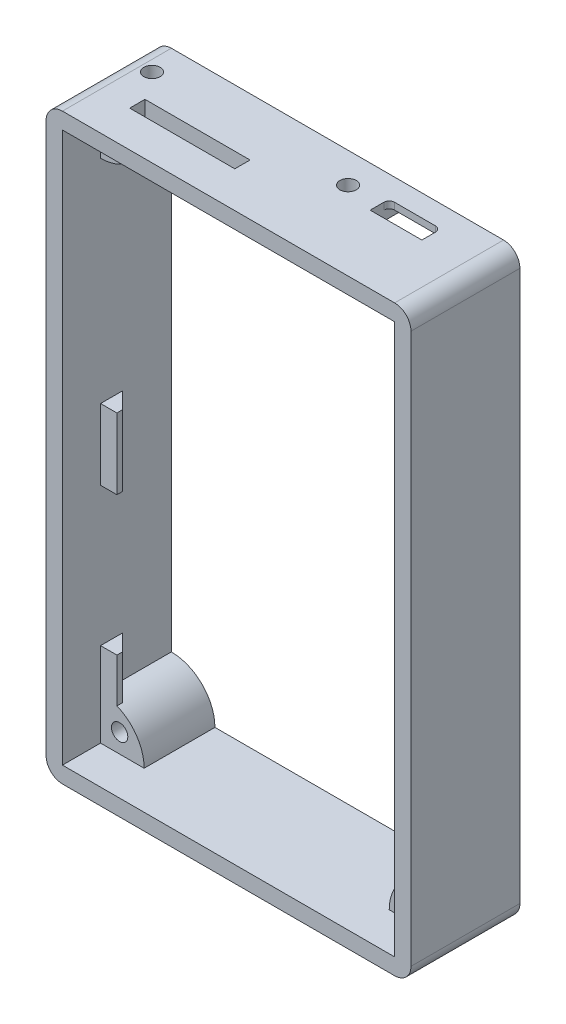
from build123d import *

# Parameters (mm, degrees)
SKICA1_W                 = 67
SKICA1_H                 = 107
SKICA1_W_2               = 61
SKICA1_H_2               = 101
P_IDAT_VYSUNUT_M1_DEPTH  = 7
P_IDAT_VYSUNUT_M2_DEPTH  = 13
SKICA3_R                 = 1.5
ODEBRAT_VYSUNUT_M1_DEPTH = 13
ODEBRAT_START            = -4.8
ODEBRAT_VYSUNUT_M2_DEPTH = 4.8
ODEBRAT_VYSUNUT_M4_DEPTH = 123.804723036
ZAOBLIT1_R               = 3
SKICA5_W                 = 4
SKICA5_H                 = 8.5
SKICA5_H_2               = 13
P_IDAT_VYSUNUT_M3_DEPTH  = 3
ZKOSEN_1_SIZE            = 3
SKICA6_W                 = 4
SKICA6_H                 = 8.5
SKICA6_H_2               = 13
P_IDAT_VYSUNUT_M4_DEPTH  = 3
ZKOSEN_2_SIZE            = 3
SKICA7_W                 = 9.5
SKICA7_H                 = 7.5
ODEBRAT_VYSUNUT_M3_DEPTH = 10
SKICA9_W                 = 9.5
SKICA9_H                 = 1.25
P_IDAT_VYSUNUT_M5_DEPTH  = 4
ZAOBLIT2_R               = 1
SKICA10_W                = 19.3
SKICA10_H                = 2.8
ODEBRAT_VYSUNUT_M5_DEPTH = 6
SKICA11_R                = 1.5
ODEBRAT_VYSUNUT_M6_DEPTH = 4
SKICA13_R                = 2.5
P_IDAT_VYSUNUT_M6_DEPTH  = 1


with BuildPart() as part:
    # Skica1 → Přidat vysunutím1 (new body)
    with BuildSketch(Plane.XY):
        with Locations((30.5, 50.5)):
            Rectangle(SKICA1_W, SKICA1_H)
        with Locations((30.5, 50.5)):
            Rectangle(SKICA1_W_2, SKICA1_H_2, mode=Mode.SUBTRACT)
    extrude(amount=P_IDAT_VYSUNUT_M1_DEPTH)

    # Skica2 → Přidat vysunutím2 (add)
    with BuildSketch(Plane(origin=(0, 0, 0), x_dir=(-1, 0, 0), z_dir=(0, 0, -1))):
        with BuildLine():
            ThreePointArc((-53, 0), (-53.14730658, -1.5281381), (-53.583801513, -3))
            Line((-53.583801513, -3), (-7.416198487, -3))
            ThreePointArc((-7.416198487, -3), (-7.85269342, -1.5281381), (-8, 0))
            Line((-8, 0), (-53, 0))
        make_face()
        with BuildLine():
            ThreePointArc((-61, 8), (-62.5281381, 7.85269342), (-64, 7.416198487))
            Line((-64, 7.416198487), (-64, -3))
            Line((-64, -3), (-53.583801513, -3))
            ThreePointArc((-53.583801513, -3), (-53.14730658, -1.5281381), (-53, 0))
            Line((-53, 0), (-61, 0))
            Line((-61, 0), (-61, 8))
        make_face()
        with BuildLine():
            ThreePointArc((-53, 0), (-55.343145751, 5.656854249), (-61, 8))
            Line((-61, 8), (-61, 0))
            Line((-61, 0), (-53, 0))
        make_face()
        with BuildLine():
            ThreePointArc((-61, 93), (-62.5281381, 93.14730658), (-64, 93.583801513))
            Line((-64, 93.583801513), (-64, 7.416198487))
            ThreePointArc((-64, 7.416198487), (-62.5281381, 7.85269342), (-61, 8))
            Line((-61, 8), (-61, 93))
        make_face()
        with BuildLine():
            Line((-53.583801513, 104), (-64, 104))
            Line((-64, 104), (-64, 93.583801513))
            ThreePointArc((-64, 93.583801513), (-62.5281381, 93.14730658), (-61, 93))
            Line((-61, 93), (-61, 101))
            Line((-61, 101), (-53, 101))
            ThreePointArc((-53, 101), (-53.14730658, 102.5281381), (-53.583801513, 104))
        make_face()
        with BuildLine():
            ThreePointArc((-61, 93), (-55.343145751, 95.343145751), (-53, 101))
            Line((-53, 101), (-61, 101))
            Line((-61, 101), (-61, 93))
        make_face()
        with BuildLine():
            Line((-7.416198487, 104), (-53.583801513, 104))
            ThreePointArc((-53.583801513, 104), (-53.14730658, 102.5281381), (-53, 101))
            Line((-53, 101), (-8, 101))
            ThreePointArc((-8, 101), (-7.85269342, 102.5281381), (-7.416198487, 104))
        make_face()
        with BuildLine():
            Line((3, 104), (-7.416198487, 104))
            ThreePointArc((-7.416198487, 104), (-7.85269342, 102.5281381), (-8, 101))
            Line((-8, 101), (0, 101))
            Line((0, 101), (0, 93))
            ThreePointArc((0, 93), (1.5281381, 93.14730658), (3, 93.583801513))
            Line((3, 93.583801513), (3, 104))
        make_face()
        with BuildLine():
            Line((0, 101), (-8, 101))
            ThreePointArc((-8, 101), (-5.656854249, 95.343145751), (0, 93))
            Line((0, 93), (0, 101))
        make_face()
        with BuildLine():
            Line((3, 7.416198487), (3, 93.583801513))
            ThreePointArc((3, 93.583801513), (1.5281381, 93.14730658), (0, 93))
            Line((0, 93), (0, 8))
            ThreePointArc((0, 8), (1.5281381, 7.85269342), (3, 7.416198487))
        make_face()
        with BuildLine():
            Line((3, -3), (3, 7.416198487))
            ThreePointArc((3, 7.416198487), (1.5281381, 7.85269342), (0, 8))
            Line((0, 8), (0, 0))
            Line((0, 0), (-8, 0))
            ThreePointArc((-8, 0), (-7.85269342, -1.5281381), (-7.416198487, -3))
            Line((-7.416198487, -3), (3, -3))
        make_face()
        with BuildLine():
            Line((0, 0), (0, 8))
            ThreePointArc((0, 8), (-5.656854249, 5.656854249), (-8, 0))
            Line((-8, 0), (0, 0))
        make_face()
    extrude(amount=P_IDAT_VYSUNUT_M2_DEPTH)

    # Skica3 → Odebrat vysunutím1 (cut)
    with BuildSketch(Plane.XY):
        with Locations((3.5, 97.5)):
            Circle(SKICA3_R)
        with Locations((3.5, 3.5)):
            Circle(SKICA3_R)
        with Locations((57.5, 3.5)):
            Circle(SKICA3_R)
        with Locations((57.5, 97.5)):
            Circle(SKICA3_R)
    extrude(amount=-ODEBRAT_VYSUNUT_M1_DEPTH, mode=Mode.SUBTRACT)

    # Skica4 → Odebrat vysunutím2 (cut)
    with BuildSketch(Plane(origin=(0, 0, -13), x_dir=(-1, 0, 0), z_dir=(0, 0, -1)).offset(ODEBRAT_START)):
        with BuildLine():
            Line((-53, 101), (-61, 101))
            Line((-61, 101), (-61, 93))
            ThreePointArc((-61, 93), (-55.343145751, 95.343145751), (-53, 101))
        make_face()
    extrude(amount=ODEBRAT_VYSUNUT_M2_DEPTH, mode=Mode.SUBTRACT)

    # Skica8 → Odebrat vysunutím4 (cut, through all)
    with BuildSketch(Plane.XY):
        with BuildLine():
            Line((61, 94.75), (57.5, 94.75))
            ThreePointArc((57.5, 94.75), (55.555456352, 95.555456352), (54.75, 97.5))
            Line((54.75, 97.5), (54.75, 101))
            Line((54.75, 101), (53, 101))
            ThreePointArc((53, 101), (55.343145751, 95.343145751), (61, 93))
            Line((61, 93), (61, 94.75))
        make_face()
    extrude(amount=-ODEBRAT_VYSUNUT_M4_DEPTH, mode=Mode.SUBTRACT)

    # Zaoblit1
    zaoblit1_edges = [part.edges().sort_by_distance(p)[0] for p in [
        (-3, 104, -3),
        (64, 104, -3),
        (64, -3, -3),
        (-3, -3, -3),
    ]]
    fillet(zaoblit1_edges, radius=ZAOBLIT1_R)

    # Skica5 → Přidat vysunutím3 (add)
    with BuildSketch(Plane(origin=(0, 0, 0), x_dir=(0, 0, -1), z_dir=(1, 0, 0))):
        with Locations((2, 11.25)):
            Rectangle(SKICA5_W, SKICA5_H)
        with Locations((2, 47.5)):
            Rectangle(SKICA5_W, SKICA5_H_2)
    extrude(amount=P_IDAT_VYSUNUT_M3_DEPTH)

    # Zkosení1
    zkosen_1_edges = [part.edges().sort_by_distance(p)[0] for p in [
        (3, 11.458099244, -4),
        (3, 47.5, -4),
    ]]
    chamfer(zkosen_1_edges, length=ZKOSEN_1_SIZE - 0.0001)  # a hair under: the kernel refuses the full size

    # Skica6 → Přidat vysunutím4 (add)
    with BuildSketch(Plane.ZY.offset(-61)):
        with Locations((-2, 11.25)):
            Rectangle(SKICA6_W, SKICA6_H)
        with Locations((-2, 47.5)):
            Rectangle(SKICA6_W, SKICA6_H_2)
    extrude(amount=P_IDAT_VYSUNUT_M4_DEPTH)

    # Zkosení2
    zkosen_2_edges = [part.edges().sort_by_distance(p)[0] for p in [
        (58, 11.458099244, -4),
        (58, 47.5, -4),
    ]]
    chamfer(zkosen_2_edges, length=ZKOSEN_2_SIZE - 0.0001)  # a hair under: the kernel refuses the full size

    # Skica7 → Odebrat vysunutím3 (cut)
    with BuildSketch(Plane(origin=(0, 104, 0), x_dir=(1, 0, 0), z_dir=(0, 1, 0))):
        with Locations((48.75, 9.25)):
            Rectangle(SKICA7_W, SKICA7_H)
    extrude(amount=-ODEBRAT_VYSUNUT_M3_DEPTH, mode=Mode.SUBTRACT)

    # Skica9 → Přidat vysunutím5 (add)
    with BuildSketch(Plane(origin=(0, 0, -13), x_dir=(-1, 0, 0), z_dir=(0, 0, -1))):
        with Locations((-48.75, 103.375)):
            Rectangle(SKICA9_W, SKICA9_H)
    extrude(amount=-P_IDAT_VYSUNUT_M5_DEPTH)

    # Zaoblit2
    zaoblit2_edges = [part.edges().sort_by_distance(p)[0] for p in [
        (53.5, 103.375, -9),
        (44, 103.375, -9),
    ]]
    fillet(zaoblit2_edges, radius=ZAOBLIT2_R)

    # Skica10 → Odebrat vysunutím5 (cut, symmetric)
    with BuildSketch(Plane.XZ.offset(-101)):
        with Locations((15.35, -1.05)):
            Rectangle(SKICA10_W, SKICA10_H)
    extrude(amount=ODEBRAT_VYSUNUT_M5_DEPTH, both=True, mode=Mode.SUBTRACT)

    # Skica11 → Odebrat vysunutím6 (cut)
    with BuildSketch(Plane(origin=(0, 104, 0), x_dir=(1, 0, 0), z_dir=(0, 1, 0))):
        with Locations(Location((38, 7.45, 0), (0, 0, 270))):
            Circle(SKICA11_R)
        with Locations(Location((2, 7.45, 0), (0, 0, 270))):
            Circle(SKICA11_R)
    extrude(amount=-ODEBRAT_VYSUNUT_M6_DEPTH, mode=Mode.SUBTRACT)

    # Skica13 → Přidat vysunutím6 (add)
    with BuildSketch(Plane.XZ.offset(-101)):
        with Locations(Location((38, -7.45, 0), (0, 0, 270))):
            Circle(SKICA13_R)
    extrude(amount=P_IDAT_VYSUNUT_M6_DEPTH)


solid = part.part
